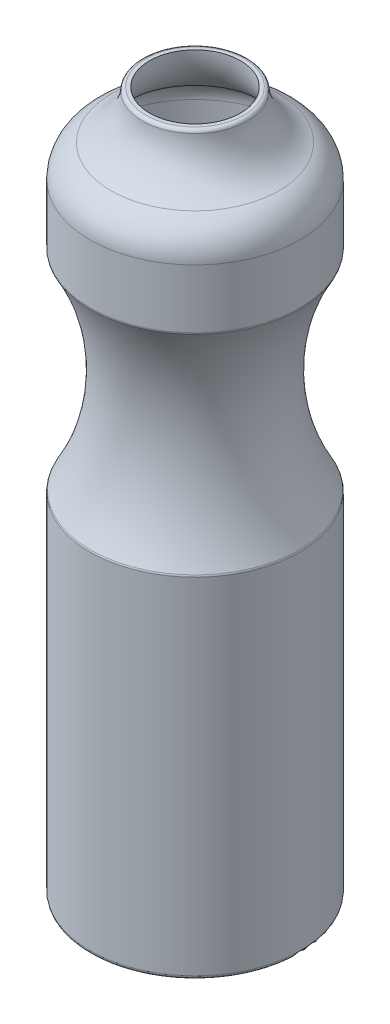
from build123d import *


# Read off the part's stored shape, not the designer's step: Shell1
with BuildPart() as part:
    # Sketch1 → Revolve1 (revolve)
    with BuildSketch(Plane(origin=(0, 0, 0), x_dir=(0, 0, -1), z_dir=(1, 0, 0))):
        with BuildLine():
            Line((0, 0), (0, 200))
            Line((0, 200), (14.031280577, 200))
            ThreePointArc((14.031280577, 200), (14.715933774, 199.728868987), (15.029325541, 199.0625))
            ThreePointArc((15.029325541, 199.0625), (17.713105506, 191.395801973), (24, 186.252272915))
            ThreePointArc((24, 186.252272915), (28.366600265, 182.5643471), (30, 177.087121525))
            Line((30, 177.087121525), (30, 160.266763149))
            ThreePointArc((30, 160.266763149), (29.966494105, 160.010074338), (29.868221709, 159.770586704))
            ThreePointArc((29.868221709, 159.770586704), (21.961524227, 130), (29.868221709, 100.229413296))
            ThreePointArc((29.868221709, 100.229413296), (29.966494105, 99.989925662), (30, 99.733236851))
            Line((30, 99.733236851), (30, 1))
            ThreePointArc((30, 1), (29.707106781, 0.292893219), (29, 0))
            Line((29, 0), (0, 0))
        make_face()
    revolve(axis=Axis((0, 0, 0), (0, 1, 0)))

    # Shell1 outline → Shell1 (revolve, cut)
    with BuildSketch(Plane.XY):
        with BuildLine():
            Line((28, 2), (28, 99.468804427))
            ThreePointArc((28, 99.468804427), (19.961524227, 130), (28, 160.531195573))
            Line((28, 160.531195573), (28, 177.087121525))
            ThreePointArc((28, 177.087121525), (26.693280212, 181.468901985), (23.2, 184.419242637))
            ThreePointArc((23.2, 184.419242637), (15.776779549, 190.688716522), (13, 200))
            Line((13, 200), (0, 200))
            Line((0, 200), (0, 2))
            Line((0, 2), (28, 2))
        make_face()
    revolve(axis=Axis((0, 0, 0), (0, 1, 0)), mode=Mode.SUBTRACT)


solid = part.part
